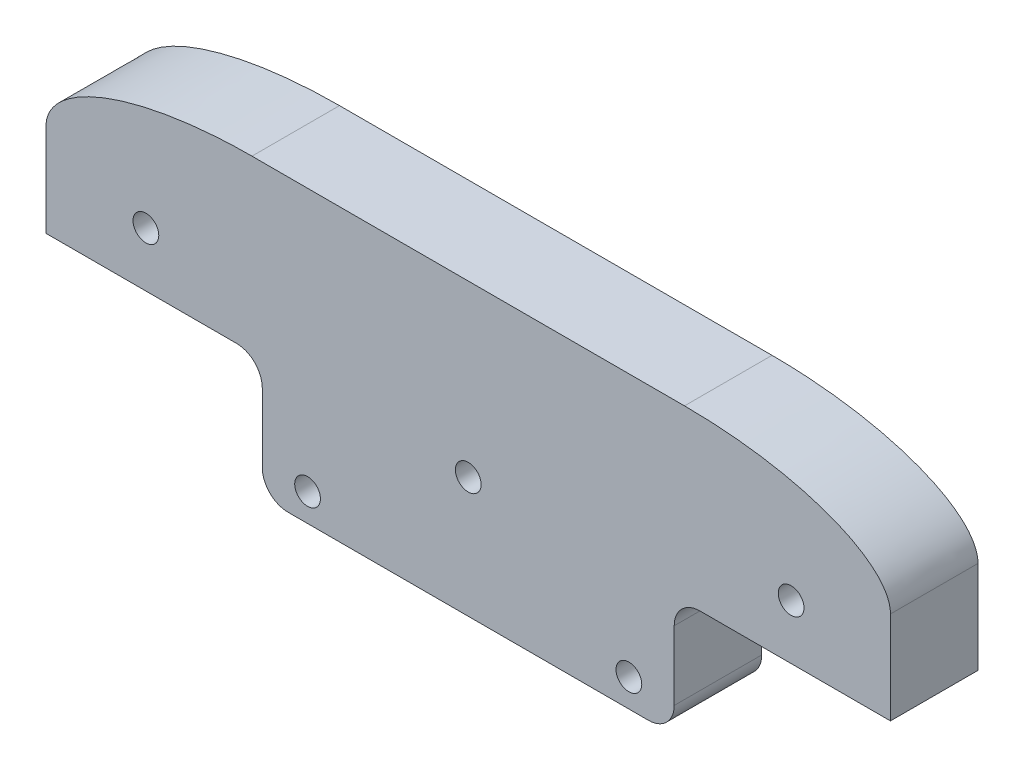
from build123d import *

# Parameters (mm, degrees)
SKETCH_1_R      = 2.5
EXTRUDE_1_DEPTH = 17
FILLET_1_SIZE   = 15
FILLET_1_SIZE_2 = 40
FILLET_2_R      = 5


with BuildPart() as part:
    # 草图1 → 凸台-拉伸1 (new body)
    with BuildSketch(Plane.XY):
        Polygon((-80, 0), (0, 0), (0, 23.4), (42, 23.4), (42, 56.39), (-122, 56.39), (-122, 23.4), (-80, 23.4), align=None)
        with Locations((-40, 23.4)):
            Circle(SKETCH_1_R, mode=Mode.SUBTRACT)
        with Locations((-71.2, 5.4)):
            Circle(SKETCH_1_R, mode=Mode.SUBTRACT)
        with Locations((-8.8, 5.4)):
            Circle(SKETCH_1_R, mode=Mode.SUBTRACT)
        with Locations((-102.6, 34)):
            Circle(SKETCH_1_R, mode=Mode.SUBTRACT)
        with Locations((22.705, 34)):
            Circle(SKETCH_1_R, mode=Mode.SUBTRACT)
    extrude(amount=EXTRUDE_1_DEPTH)

    # 圆角1
    # an asymmetric fillet: 40, 15 mm, written as the material it takes off along each edge
    with BuildSketch(Plane(origin=(42, 56.39, -100), x_dir=(0, -1, 0), z_dir=(0, 0, 1))) as fillet_1_piece_1:
        with BuildLine():
            Bezier((FILLET_1_SIZE, 0), (0, 0), (0, -FILLET_1_SIZE_2), weights=[1, 0.707106781, 1])
            Line((0, -FILLET_1_SIZE_2), (0, 0))
            Line((0, 0), (FILLET_1_SIZE, 0))
        make_face()
    extrude(amount=217, mode=Mode.SUBTRACT)
    with BuildSketch(Plane(origin=(-122, 56.39, -100), x_dir=(1, 0, 0), z_dir=(0, 0, 1))) as fillet_1_piece_2:
        with BuildLine():
            Bezier((FILLET_1_SIZE_2, 0), (0, 0), (0, -FILLET_1_SIZE), weights=[1, 0.707106781, 1])
            Line((0, -FILLET_1_SIZE), (0, 0))
            Line((0, 0), (FILLET_1_SIZE_2, 0))
        make_face()
    extrude(amount=217, mode=Mode.SUBTRACT)

    # 圆角2
    fillet_2_edges = [part.edges().sort_by_distance(p)[0] for p in [
        (0, 0, 8.5),
        (-80, 0, 8.5),
        (-80, 23.4, 8.5),
        (0, 23.4, 8.5),
    ]]
    fillet(fillet_2_edges, radius=FILLET_2_R)


solid = part.part
